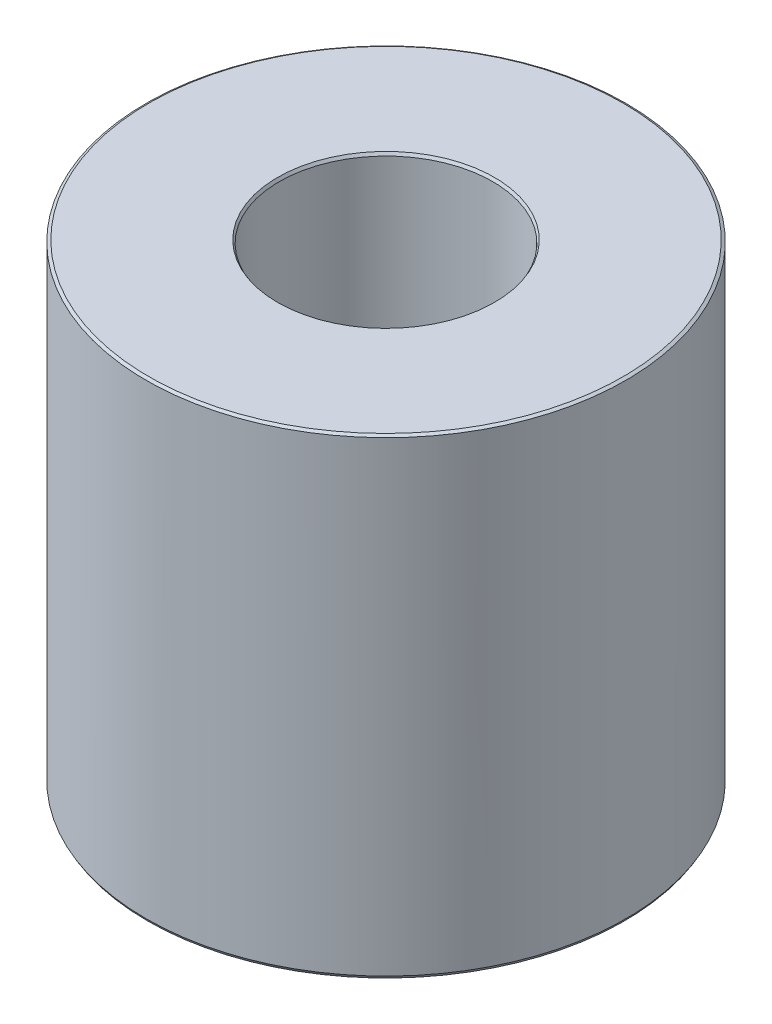
from build123d import *
from OCP.BRepFilletAPI import BRepFilletAPI_MakeChamfer

# Parameters (mm, degrees)
SKETCH1_R           = 40
BOSS_EXTRUDE1_DEPTH = 78.500390828
SKETCH2_R           = 17.798359469
CUT_EXTRUDE1_DEPTH  = 97.759037615
CHAMFER1_SIZE       = 0.274661857
CHAMFER1_SIZE2      = 0.475728292


with BuildPart() as part:
    # Sketch1 → Boss-Extrude1 (new body)
    with BuildSketch(Plane(origin=(0, 0, 0), x_dir=(1, 0, 0), z_dir=(0, 1, 0))):
        Circle(SKETCH1_R)
    extrude(amount=BOSS_EXTRUDE1_DEPTH)

    # Sketch2 → Cut-Extrude1 (cut, through all)
    with BuildSketch(Plane(origin=(0, 0, 0), x_dir=(1, 0, 0), z_dir=(0, 1, 0))):
        Circle(SKETCH2_R)
    extrude(amount=CUT_EXTRUDE1_DEPTH, mode=Mode.SUBTRACT)

    # Chamfer1: one chamfer whose edges measure the first distance from different faces: ONE call of the kernel's chamfer builder (chamfer() names one face for all edges)
    chamfer1_edges_1 = [part.edges().sort_by_distance(p)[0] for p in [
        (-17.798359469, 78.500390828, 0),
    ]]
    chamfer1_side_1 = [part.faces().sort_by_distance(p)[0] for p in [
        (-38.86862915, 78.500390828, 0),
    ]]
    chamfer1_edges_2 = [part.edges().sort_by_distance(p)[0] for p in [
        (-17.798359469, 0, 0),
    ]]
    chamfer1_side_2 = [part.faces().sort_by_distance(p)[0] for p in [
        (-17.798359469, 39.250195414, 0),
    ]]
    chamfer1_edges_3 = [part.edges().sort_by_distance(p)[0] for p in [
        (-40, 0, 0),
    ]]
    chamfer1_side_3 = [part.faces().sort_by_distance(p)[0] for p in [
        (-38.86862915, 0, 0),
    ]]
    chamfer1_edges_4 = [part.edges().sort_by_distance(p)[0] for p in [
        (-40, 78.500390828, 0),
    ]]
    chamfer1_side_4 = [part.faces().sort_by_distance(p)[0] for p in [
        (-40, 39.250195414, 0),
    ]]
    chamfer1 = BRepFilletAPI_MakeChamfer(part.part.solid().wrapped)
    for e in chamfer1_edges_1:
        chamfer1.Add(CHAMFER1_SIZE, CHAMFER1_SIZE2, e.wrapped, chamfer1_side_1[0].wrapped)  # the first distance lies on this face
    for e in chamfer1_edges_2:
        chamfer1.Add(CHAMFER1_SIZE, CHAMFER1_SIZE2, e.wrapped, chamfer1_side_2[0].wrapped)  # the first distance lies on this face
    for e in chamfer1_edges_3:
        chamfer1.Add(CHAMFER1_SIZE, CHAMFER1_SIZE2, e.wrapped, chamfer1_side_3[0].wrapped)  # the first distance lies on this face
    for e in chamfer1_edges_4:
        chamfer1.Add(CHAMFER1_SIZE, CHAMFER1_SIZE2, e.wrapped, chamfer1_side_4[0].wrapped)  # the first distance lies on this face
    add(Compound.cast(chamfer1.Shape()), mode=Mode.REPLACE)


solid = part.part
